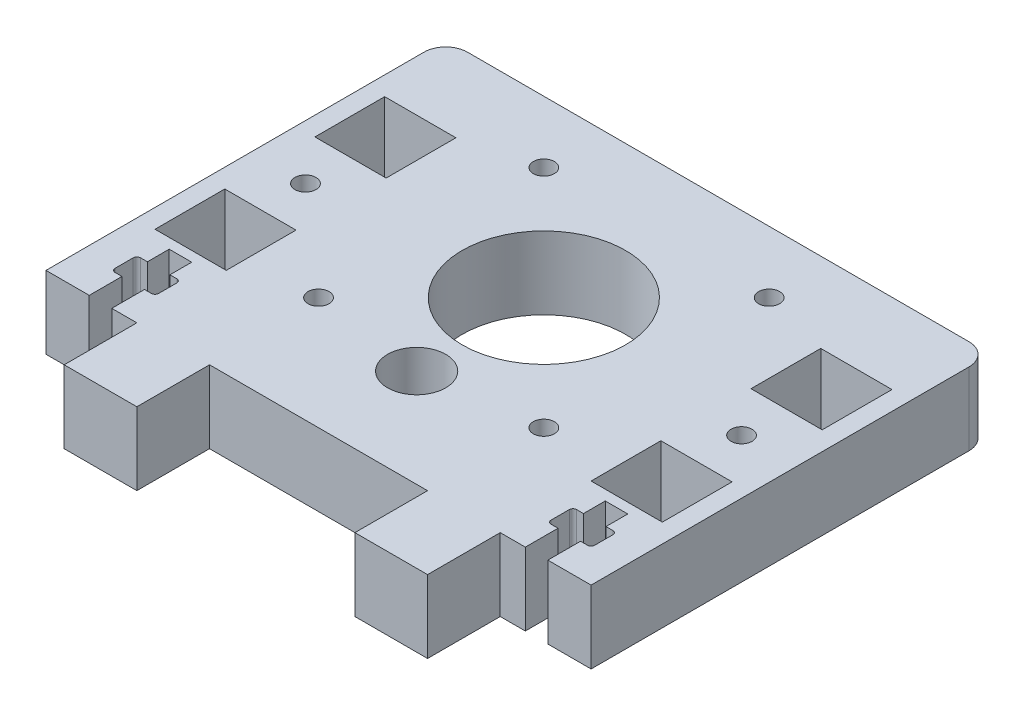
from build123d import *

# Parameters (mm, degrees)
SKETCH1_R        = 1.45
SKETCH1_W        = 9.8
SKETCH1_H        = 9.6
MAINLAYOUT_DEPTH = 10
TSLOT_DEPTH      = 53.936282454


with BuildPart() as part:
    # Sketch1 → MainLayout (new body)
    with BuildSketch(Plane(origin=(0, 0, 0), x_dir=(1, 0, 0), z_dir=(0, 1, 0))):
        with BuildLine():
            Line((-34.5, 29), (0, 29))
            Line((0, 29), (0, 16.25))
            ThreePointArc((0, 16.25), (-11.25, 5), (0, -6.25))
            Line((0, -6.25), (0, -8.5))
            ThreePointArc((0, -8.5), (-4, -12.5), (0, -16.5))
            Line((0, -16.5), (0, -26))
            Line((0, -26), (-15, -26))
            Line((-15, -26), (-15, -36))
            Line((-15, -36), (-25, -36))
            Line((-25, -36), (-25, -26))
            Line((-25, -26), (-37.5, -26))
            Line((-37.5, -26), (-37.5, 26))
            ThreePointArc((-37.5, 26), (-36.621320344, 28.121320344), (-34.5, 29))
        make_face()
        with Locations((-15.5, 20.5)):
            Circle(SKETCH1_R, mode=Mode.SUBTRACT)
        with Locations((-15.5, -10.5)):
            Circle(SKETCH1_R, mode=Mode.SUBTRACT)
        with Locations((-30, 2.2)):
            Circle(SKETCH1_R, mode=Mode.SUBTRACT)
        with Locations((-30, 13.2)):
            Rectangle(SKETCH1_W, SKETCH1_H, mode=Mode.SUBTRACT)
        with Locations((-30, -8.8)):
            Rectangle(SKETCH1_W, SKETCH1_H, mode=Mode.SUBTRACT)
    mainlayout = extrude(amount=MAINLAYOUT_DEPTH)

    # Sketch2 → TSlot (cut, through all)
    with BuildSketch(Plane(origin=(0, 10, 0), x_dir=(1, 0, 0), z_dir=(0, 1, 0))):
        with BuildLine():
            Line((-28.45, -21.5), (-28.45, -26))
            Line((-28.45, -26), (-31.55, -26))
            Line((-31.55, -26), (-31.55, -21.5))
            Line((-31.55, -21.5), (-32.5, -21.5))
            ThreePointArc((-32.5, -21.5), (-32.853553391, -21.353553391), (-33, -21))
            Line((-33, -21), (-33, -18.5))
            ThreePointArc((-33, -18.5), (-32.853553391, -18.146446609), (-32.5, -18))
            Line((-32.5, -18), (-31.55, -18))
            Line((-31.55, -18), (-31.55, -15))
            Line((-31.55, -15), (-28.45, -15))
            Line((-28.45, -15), (-28.45, -18))
            Line((-28.45, -18), (-27.5, -18))
            ThreePointArc((-27.5, -18), (-27.146446609, -18.146446609), (-27, -18.5))
            Line((-27, -18.5), (-27, -21))
            ThreePointArc((-27, -21), (-27.146446609, -21.353553391), (-27.5, -21.5))
            Line((-27.5, -21.5), (-28.45, -21.5))
        make_face()
    tslot = extrude(amount=-TSLOT_DEPTH, mode=Mode.SUBTRACT)

    # Mirror1: MainLayout, TSlot across plane
    add(mainlayout.mirror(Plane(origin=(0, 0, 0), x_dir=(0, 0, 1), z_dir=(1, 0, 0))))
    add(tslot.mirror(Plane(origin=(0, 0, 0), x_dir=(0, 0, 1), z_dir=(1, 0, 0))), mode=Mode.SUBTRACT)


solid = part.part
